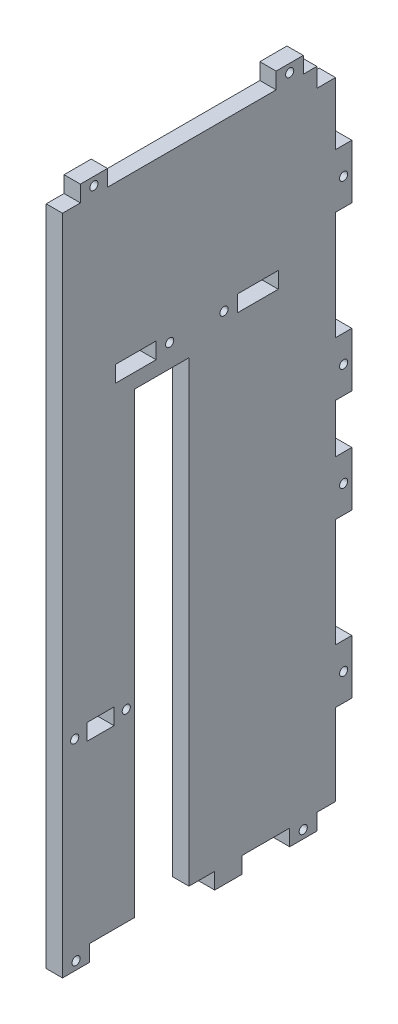
from build123d import *

# Parameters (mm, degrees)
ESQUISSE1_W             = 100.58
ESQUISSE1_H             = 238
ESQUISSE1_W_2           = 10
ESQUISSE1_H_2           = 6
ESQUISSE1_W_3           = 15
BOSS_EXTRU_1_DEPTH      = 6
ESQUISSE3_W             = 10
ESQUISSE3_H             = 6
ESQUISSE3_W_2           = 6
ESQUISSE3_H_2           = 20
BOSS_EXTRU_5_DEPTH      = 6
ESQUISSE6_W             = 20
ESQUISSE6_H             = 168.59
ENL_V_MAT_EXTRU_2_DEPTH = 6
ESQUISSE7_W             = 6.88
ESQUISSE7_H             = 7
ENL_V_MAT_EXTRU_3_DEPTH = 6
ESQUISSE8_R             = 1.5
ENL_V_MAT_EXTRU_4_DEPTH = 6


with BuildPart() as part:
    # Esquisse1 → Boss.-Extru.1 (new body)
    with BuildSketch(Plane(origin=(0, 0, 0), x_dir=(0, 0, -1), z_dir=(1, 0, 0))):
        Rectangle(ESQUISSE1_W, ESQUISSE1_H)
        with Locations((-36.29, -51)):
            Rectangle(ESQUISSE1_W_2, ESQUISSE1_H_2, mode=Mode.SUBTRACT)
        with Locations((-23.295, 58)):
            Rectangle(ESQUISSE1_W_3, ESQUISSE1_H_2, mode=Mode.SUBTRACT)
        with Locations((21.705, 58)):
            Rectangle(ESQUISSE1_W_3, ESQUISSE1_H_2, mode=Mode.SUBTRACT)
    extrude(amount=BOSS_EXTRU_1_DEPTH)

    # Esquisse3 → Boss.-Extru.5 (add)
    with BuildSketch(Plane(origin=(6, 0, 0), x_dir=(0, 0, -1), z_dir=(1, 0, 0))):
        with Locations((-45.29, -122)):
            Rectangle(ESQUISSE3_W, ESQUISSE3_H)
        with Locations((38.41, -122)):
            Rectangle(ESQUISSE3_W, ESQUISSE3_H)
        with Locations((53.29, 19)):
            Rectangle(ESQUISSE3_W_2, ESQUISSE3_H_2)
        with Locations((53.29, 79)):
            Rectangle(ESQUISSE3_W_2, ESQUISSE3_H_2)
        with Locations((53.29, -79)):
            Rectangle(ESQUISSE3_W_2, ESQUISSE3_H_2)
        with Locations((53.29, -19)):
            Rectangle(ESQUISSE3_W_2, ESQUISSE3_H_2)
        with Locations((10.79, -122)):
            Rectangle(ESQUISSE3_W, ESQUISSE3_H)
        with Locations((33.41, 122)):
            Rectangle(ESQUISSE3_W, ESQUISSE3_H)
        with Locations((-38.71, 122)):
            Rectangle(ESQUISSE3_W, ESQUISSE3_H)
    extrude(amount=-BOSS_EXTRU_5_DEPTH)

    # Esquisse6 → Enlèv. mat.-Extru.2 (cut)
    with BuildSketch(Plane(origin=(6, 0, 0), x_dir=(0, 0, -1), z_dir=(1, 0, 0))):
        with Locations((-13.71, -34.705)):
            Rectangle(ESQUISSE6_W, ESQUISSE6_H)
    extrude(amount=-ENL_V_MAT_EXTRU_2_DEPTH, mode=Mode.SUBTRACT)

    # Esquisse7 → Enlèv. mat.-Extru.3 (cut)
    with BuildSketch(Plane.ZY):
        with Locations((-46.85, 115.5)):
            Rectangle(ESQUISSE7_W, ESQUISSE7_H)
    extrude(amount=-ENL_V_MAT_EXTRU_3_DEPTH, mode=Mode.SUBTRACT)

    # Esquisse8 → Enlèv. mat.-Extru.4 (cut)
    with BuildSketch(Plane.ZY):
        with Locations((-9.205, 58)):
            Circle(ESQUISSE8_R)
        with Locations((10.795, 58)):
            Circle(ESQUISSE8_R)
        with Locations((26.79, -51)):
            Circle(ESQUISSE8_R)
        with Locations((45.79, -51)):
            Circle(ESQUISSE8_R)
        with Locations((38.71, 122)):
            Circle(ESQUISSE8_R)
        with Locations((-33.41, 122)):
            Circle(ESQUISSE8_R)
        with Locations((45.29, -122)):
            Circle(ESQUISSE8_R)
        with Locations((-53.29, 79)):
            Circle(ESQUISSE8_R)
        with Locations((-38.41, -122)):
            Circle(ESQUISSE8_R)
        with Locations((-53.29, 19)):
            Circle(ESQUISSE8_R)
        with Locations((-53.29, -79)):
            Circle(ESQUISSE8_R)
        with Locations((-53.29, -19)):
            Circle(ESQUISSE8_R)
    extrude(amount=-ENL_V_MAT_EXTRU_4_DEPTH, mode=Mode.SUBTRACT)


solid = part.part
